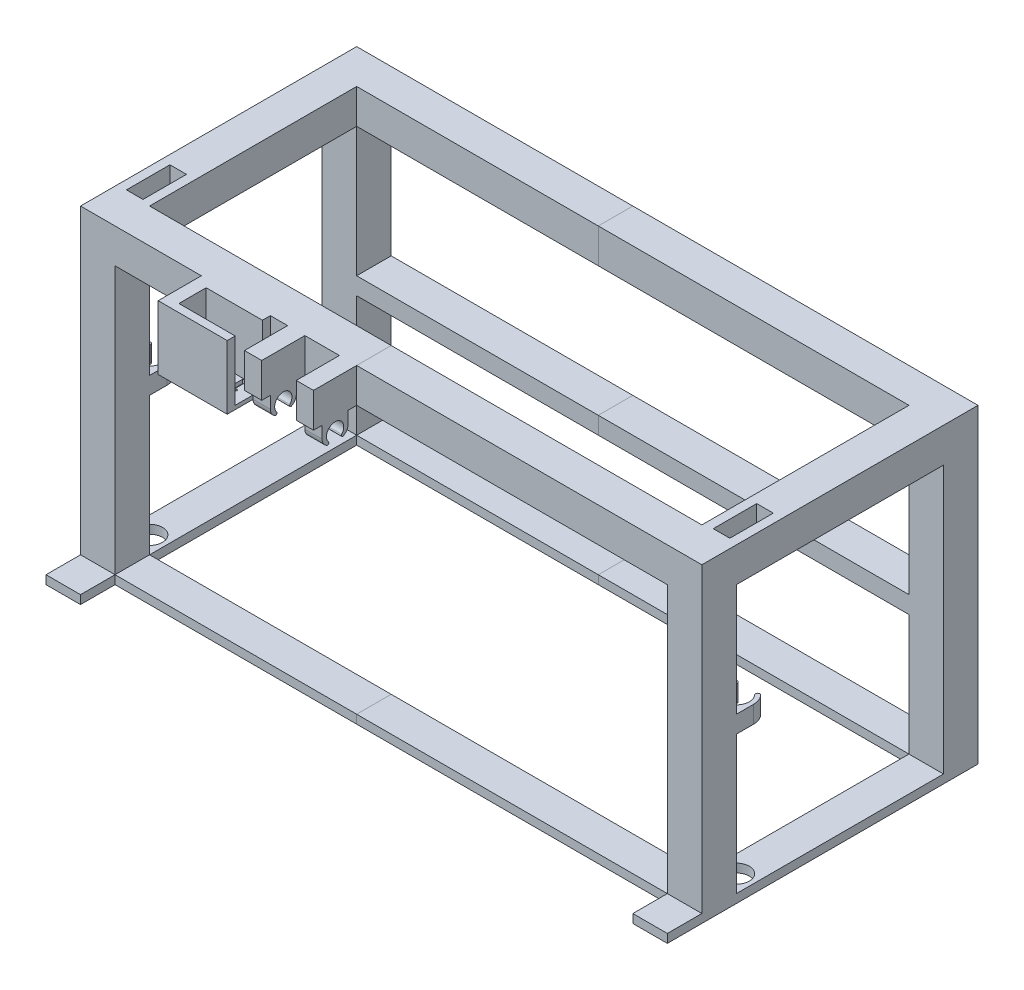
from build123d import *

# Parameters (mm, degrees)
SKETCH1_W            = 25.4
SKETCH1_H            = 25.4
SKETCH1_W_2          = 406.4
SKETCH1_H_2          = 152.4
BOSS_EXTRUDE1_DEPTH  = 6.35
SKETCH1_4_W          = 25.4
SKETCH1_4_H          = 25.4
BOSS_EXTRUDE2_DEPTH  = 228.6
BOSS_EXTRUDE3_START  = 203.2
SKETCH1_5_W          = 406.4
SKETCH1_5_H          = 25.4
SKETCH1_5_W_2        = 25.4
SKETCH1_5_H_2        = 152.4
BOSS_EXTRUDE3_DEPTH  = 25.4
SKETCH2_W            = 50.8
SKETCH2_H            = 25.4
SKETCH2_W_2          = 12.7
BOSS_EXTRUDE4_DEPTH  = 31.75
SKETCH11_R           = 9.525
CUT_EXTRUDE6_DEPTH   = 346.594046534
SKETCH12_W           = 12.192
SKETCH12_H           = 22.606
SKETCH12_H_2         = 4.699
CUT_EXTRUDE7_DEPTH   = 16.764
SKETCH12_3_W         = 12.192
SKETCH12_3_H         = 22.606
CUT_EXTRUDE8_DEPTH   = 25.4
SKETCH13_W           = 12.192
SKETCH13_H           = 22.606
CUT_EXTRUDE9_DEPTH   = 25.4
SKETCH13_3_W         = 12.192
SKETCH13_3_H         = 4.699
CUT_EXTRUDE10_DEPTH  = 16.764
BOSS_EXTRUDE7_START  = 88.9
SKETCH14_W           = 177.8
SKETCH14_H           = 25.4
BOSS_EXTRUDE7_DEPTH  = 12.7
BOSS_EXTRUDE8_START  = 88.9
SKETCH14_3_W         = 228.6
SKETCH14_3_H         = 25.4
BOSS_EXTRUDE8_DEPTH  = 12.7
BOSS_EXTRUDE9_START  = 101.6
BOSS_EXTRUDE9_DEPTH  = 12.7
BOSS_EXTRUDE10_START = 101.6
BOSS_EXTRUDE10_DEPTH = 12.7
BOSS_EXTRUDE11_START = -12.7
BOSS_EXTRUDE11_DEPTH = 12.7
BOSS_EXTRUDE12_START = -38.1
BOSS_EXTRUDE12_DEPTH = 12.7
SKETCH18_W           = 50.8
SKETCH18_H           = 31.75
BOSS_EXTRUDE13_DEPTH = 21.59
SKETCH19_W           = 41.402
SKETCH19_H           = 20.066
CUT_EXTRUDE11_DEPTH  = 44.196
SKETCH20_W           = 4.5
SKETCH20_H           = 7
CUT_EXTRUDE13_DEPTH  = 321.970987162


# Read off the part's stored shape, not the designer's step: Split1, Boss-Extrude11
with BuildPart() as part:
    # Sketch1 → Boss-Extrude1 (new body)
    with BuildSketch(Plane(origin=(0, 0, 0), x_dir=(1, 0, 0), z_dir=(0, 1, 0))):
        with Locations((-215.9, -88.9)):
            Rectangle(SKETCH1_W, SKETCH1_H)
        with Locations((-215.9, -114.3)):
            Rectangle(SKETCH1_W, SKETCH1_H)
        with Locations((0, -88.9)):
            Rectangle(SKETCH1_W_2, SKETCH1_H)
        with Locations((215.9, -88.9)):
            Rectangle(SKETCH1_W, SKETCH1_H)
        with Locations((215.9, -114.3)):
            Rectangle(SKETCH1_W, SKETCH1_H)
        with Locations((0, 88.9)):
            Rectangle(SKETCH1_W_2, SKETCH1_H)
        with Locations((-215.9, 0)):
            Rectangle(SKETCH1_W, SKETCH1_H_2)
        with Locations((215.9, 0)):
            Rectangle(SKETCH1_W, SKETCH1_H_2)
    extrude(amount=BOSS_EXTRUDE1_DEPTH)

    # Sketch1<4> → Boss-Extrude2 (add)
    with BuildSketch(Plane(origin=(0, 0, 0), x_dir=(1, 0, 0), z_dir=(0, 1, 0))):
        with Locations((-215.9, -88.9)):
            Rectangle(SKETCH1_4_W, SKETCH1_4_H)
        with Locations((215.9, -88.9)):
            Rectangle(SKETCH1_4_W, SKETCH1_4_H)
        with Locations((215.9, 88.9)):
            Rectangle(SKETCH1_4_W, SKETCH1_4_H)
        with Locations((-215.9, 88.9)):
            Rectangle(SKETCH1_4_W, SKETCH1_4_H)
    extrude(amount=BOSS_EXTRUDE2_DEPTH)

    # Sketch1<5> → Boss-Extrude3 (add)
    with BuildSketch(Plane(origin=(0, 0, 0), x_dir=(1, 0, 0), z_dir=(0, 1, 0)).offset(BOSS_EXTRUDE3_START)):
        with Locations((0, 88.9)):
            Rectangle(SKETCH1_5_W, SKETCH1_5_H)
        with Locations((0, -88.9)):
            Rectangle(SKETCH1_5_W, SKETCH1_5_H)
        with Locations((-215.9, 0)):
            Rectangle(SKETCH1_5_W_2, SKETCH1_5_H_2)
        with Locations((215.9, 0)):
            Rectangle(SKETCH1_5_W_2, SKETCH1_5_H_2)
    extrude(amount=BOSS_EXTRUDE3_DEPTH)

    # Sketch2 → Boss-Extrude4 (add)
    with BuildSketch(Plane.XY.offset(101.6)):
        with Locations((-114.3, 215.9)):
            Rectangle(SKETCH2_W, SKETCH2_H)
        with Locations((-69.85, 215.9)):
            Rectangle(SKETCH2_W_2, SKETCH2_H)
        with Locations((-31.75, 215.9)):
            Rectangle(SKETCH2_W_2, SKETCH2_H)
    extrude(amount=BOSS_EXTRUDE4_DEPTH)


with BuildPart() as body_2:
    # Split1: the piece on the far side of the plane
    add(part.part)
    split(bisect_by=Plane.YZ.offset(-25.4), keep=Keep.BOTTOM)


with BuildPart() as part_1:
    add(part.part)

    # Split1
    split(bisect_by=Plane.YZ.offset(-25.4), keep=Keep.TOP)


with BuildPart() as cut_extrude6_tool:
    # Sketch11 → Cut-Extrude6 (new, through all)
    with BuildSketch(Plane(origin=(0, 6.35, 0), x_dir=(1, 0, 0), z_dir=(0, 1, 0))):
        with Locations(Location((-215.9, -63.5, 0), (0, 0, 270))):
            Circle(SKETCH11_R)
        with Locations(Location((215.9, -63.5, 0), (0, 0, 90))):
            Circle(SKETCH11_R)
    extrude(amount=-CUT_EXTRUDE6_DEPTH)


with BuildPart() as part_2:
    add(part_1.part)

    # Cut-Extrude6: cut by cut_extrude6_tool
    add(cut_extrude6_tool.part, mode=Mode.SUBTRACT)

    # Sketch13 → Cut-Extrude9 (cut)
    with BuildSketch(Plane(origin=(0, 228.6, 0), x_dir=(1, 0, 0), z_dir=(0, 1, 0))):
        with Locations((215.9, -58.42)):
            Rectangle(SKETCH13_W, SKETCH13_H)
    extrude(amount=-CUT_EXTRUDE9_DEPTH, mode=Mode.SUBTRACT)

    # Sketch13<3> → Cut-Extrude10 (cut)
    with BuildSketch(Plane(origin=(0, 228.6, 0), x_dir=(1, 0, 0), z_dir=(0, 1, 0))):
        with Locations((215.9, -44.7675)):
            Rectangle(SKETCH13_3_W, SKETCH13_3_H)
        with Locations((215.9, -72.0725)):
            Rectangle(SKETCH13_3_W, SKETCH13_3_H)
    extrude(amount=-CUT_EXTRUDE10_DEPTH, mode=Mode.SUBTRACT)


with BuildPart() as body_2_1:
    add(body_2.part)

    # Cut-Extrude6: cut by cut_extrude6_tool
    add(cut_extrude6_tool.part, mode=Mode.SUBTRACT)

    # Sketch12 → Cut-Extrude7 (cut)
    with BuildSketch(Plane(origin=(0, 228.6, 0), x_dir=(1, 0, 0), z_dir=(0, 1, 0))):
        with Locations((-215.9, -58.42)):
            Rectangle(SKETCH12_W, SKETCH12_H)
        with Locations((-215.9, -44.7675)):
            Rectangle(SKETCH12_W, SKETCH12_H_2)
        with Locations((-215.9, -72.0725)):
            Rectangle(SKETCH12_W, SKETCH12_H_2)
    extrude(amount=-CUT_EXTRUDE7_DEPTH, mode=Mode.SUBTRACT)

    # Sketch12<3> → Cut-Extrude8 (cut)
    with BuildSketch(Plane(origin=(0, 228.6, 0), x_dir=(1, 0, 0), z_dir=(0, 1, 0))):
        with Locations((-215.9, -58.42)):
            Rectangle(SKETCH12_3_W, SKETCH12_3_H)
    extrude(amount=-CUT_EXTRUDE8_DEPTH, mode=Mode.SUBTRACT)


with BuildPart() as body_3:
    # Sketch14 → Boss-Extrude7 (new body)
    with BuildSketch(Plane(origin=(0, 6.35, 0), x_dir=(1, 0, 0), z_dir=(0, 1, 0)).offset(BOSS_EXTRUDE7_START)):
        with Locations((-114.3, 88.9)):
            Rectangle(SKETCH14_W, SKETCH14_H)
    extrude(amount=BOSS_EXTRUDE7_DEPTH)

    # Combine1: union body 2
    add(body_2_1.part)

    # Sketch16<3> → Boss-Extrude10 (add)
    with BuildSketch(Plane(origin=(0, 6.35, 0), x_dir=(1, 0, 0), z_dir=(0, 1, 0)).offset(BOSS_EXTRUDE10_START)):
        with BuildLine():
            Line((-228.6, -76.2), (-203.2, -76.2))
            Line((-203.2, -76.2), (-203.2, -63.5))
            ThreePointArc((-203.2, -63.5), (-204.032171439, -58.978424472), (-206.419629175, -55.049404222))
            ThreePointArc((-206.419629175, -55.049404222), (-208.661, -54.920682341), (-208.789721881, -57.162053166))
            ThreePointArc((-208.789721881, -57.162053166), (-215.9, -73.025), (-223.010278119, -57.162053166))
            ThreePointArc((-223.010278119, -57.162053166), (-223.139, -54.920682341), (-225.380370825, -55.049404222))
            ThreePointArc((-225.380370825, -55.049404222), (-227.767828561, -58.978424472), (-228.6, -63.5))
            Line((-228.6, -63.5), (-228.6, -76.2))
        make_face()
    extrude(amount=BOSS_EXTRUDE10_DEPTH)


with BuildPart() as body_3_2:
    # Sketch14<3> → Boss-Extrude8 (new body)
    with BuildSketch(Plane(origin=(0, 6.35, 0), x_dir=(1, 0, 0), z_dir=(0, 1, 0)).offset(BOSS_EXTRUDE8_START)):
        with Locations((88.9, 88.9)):
            Rectangle(SKETCH14_3_W, SKETCH14_3_H)
    extrude(amount=BOSS_EXTRUDE8_DEPTH)

    # Combine2: union part
    add(part_2.part)

    # Sketch16 → Boss-Extrude9 (add)
    with BuildSketch(Plane(origin=(0, 6.35, 0), x_dir=(1, 0, 0), z_dir=(0, 1, 0)).offset(BOSS_EXTRUDE9_START)):
        with BuildLine():
            Line((228.6, -76.2), (228.6, -63.5))
            ThreePointArc((228.6, -63.5), (227.767828561, -58.978424472), (225.380370825, -55.049404222))
            ThreePointArc((225.380370825, -55.049404222), (223.139, -54.920682341), (223.010278119, -57.162053166))
            ThreePointArc((223.010278119, -57.162053166), (215.9, -73.025), (208.789721881, -57.162053166))
            ThreePointArc((208.789721881, -57.162053166), (208.661, -54.920682341), (206.419629175, -55.049404222))
            ThreePointArc((206.419629175, -55.049404222), (204.032171439, -58.978424472), (203.2, -63.5))
            Line((203.2, -63.5), (203.2, -76.2))
            Line((203.2, -76.2), (228.6, -76.2))
        make_face()
    extrude(amount=BOSS_EXTRUDE9_DEPTH)


with BuildPart() as body_3_3:
    # Boss-Extrude11 outline → Boss-Extrude11 (new body)
    with BuildSketch(Plane(origin=(-25.4, 0, 0), x_dir=(0, 0, -1), z_dir=(1, 0, 0)).offset(BOSS_EXTRUDE11_START)):
        with BuildLine():
            Line((-107.912924793, 194.31), (-107.912924793, 203.2))
            Line((-107.912924793, 203.2), (-127.037075207, 203.2))
            Line((-127.037075207, 203.2), (-127.037075207, 194.31))
            ThreePointArc((-127.037075207, 194.31), (-126.097662943, 190.986140746), (-123.557377461, 188.645737915))
            ThreePointArc((-123.557377461, 188.645737915), (-122.301, 188.922066518), (-122.322525086, 190.208292973))
            ThreePointArc((-122.322525086, 190.208292973), (-117.475, 200.66), (-112.627474914, 190.208292973))
            ThreePointArc((-112.627474914, 190.208292973), (-112.649, 188.922066518), (-111.392622539, 188.645737915))
            ThreePointArc((-111.392622539, 188.645737915), (-108.852337057, 190.986140746), (-107.912924793, 194.31))
        make_face()
    extrude(amount=BOSS_EXTRUDE11_DEPTH)


with BuildPart() as body_4:
    # Sketch17<2> → Boss-Extrude12 (new body)
    with BuildSketch(Plane(origin=(-25.4, 0, 0), x_dir=(0, 0, -1), z_dir=(1, 0, 0)).offset(BOSS_EXTRUDE12_START)):
        with BuildLine():
            Line((-107.912924793, 203.2), (-127.037075207, 203.2))
            Line((-127.037075207, 203.2), (-127.037075207, 194.31))
            ThreePointArc((-127.037075207, 194.31), (-126.097662943, 190.986140745), (-123.557377461, 188.645737915))
            ThreePointArc((-123.557377461, 188.645737915), (-122.301, 188.922066518), (-122.322525086, 190.208292973))
            ThreePointArc((-122.322525086, 190.208292973), (-117.475, 200.66), (-112.627474914, 190.208292973))
            ThreePointArc((-112.627474914, 190.208292973), (-112.649, 188.922066518), (-111.392622539, 188.645737915))
            ThreePointArc((-111.392622539, 188.645737915), (-108.852337057, 190.986140745), (-107.912924793, 194.31))
            Line((-107.912924793, 194.31), (-107.912924793, 203.2))
        make_face()
    extrude(amount=-BOSS_EXTRUDE12_DEPTH)


with BuildPart() as body_5:
    # Sketch18 → Boss-Extrude13 (new body)
    with BuildSketch(Plane.XZ.offset(-203.2)):
        with Locations((-114.3, 117.475)):
            Rectangle(SKETCH18_W, SKETCH18_H)
    extrude(amount=BOSS_EXTRUDE13_DEPTH)


with BuildPart() as body_3_1:
    add(body_3.part)

    # Combine3: union body 3 3, body 5, body 4
    add(body_3_3.part)
    add(body_5.part)
    add(body_4.part)

    # Sketch19 → Cut-Extrude11 (cut)
    with BuildSketch(Plane(origin=(0, 228.6, 0), x_dir=(1, 0, 0), z_dir=(0, 1, 0))):
        with Locations((-109.601, -117.475)):
            Rectangle(SKETCH19_W, SKETCH19_H)
    extrude(amount=-CUT_EXTRUDE11_DEPTH, mode=Mode.SUBTRACT)

    # Sketch20 → Cut-Extrude13 (cut, through all)
    with BuildSketch(Plane.XZ.offset(-181.61)):
        Polygon((-97.610434743, 116.692), (-97.610434743, 118.192), (-99.602, 118.192), (-99.602, 126.842), (-102.802, 126.842), (-102.802, 108.042), (-99.602, 108.042), (-99.602, 116.692), align=None)
        with Locations((-125.052, 117.442)):
            Rectangle(SKETCH20_W, SKETCH20_H)
    extrude(amount=-CUT_EXTRUDE13_DEPTH, mode=Mode.SUBTRACT)


solid = Compound([body_3_2.part, body_3_1.part])
